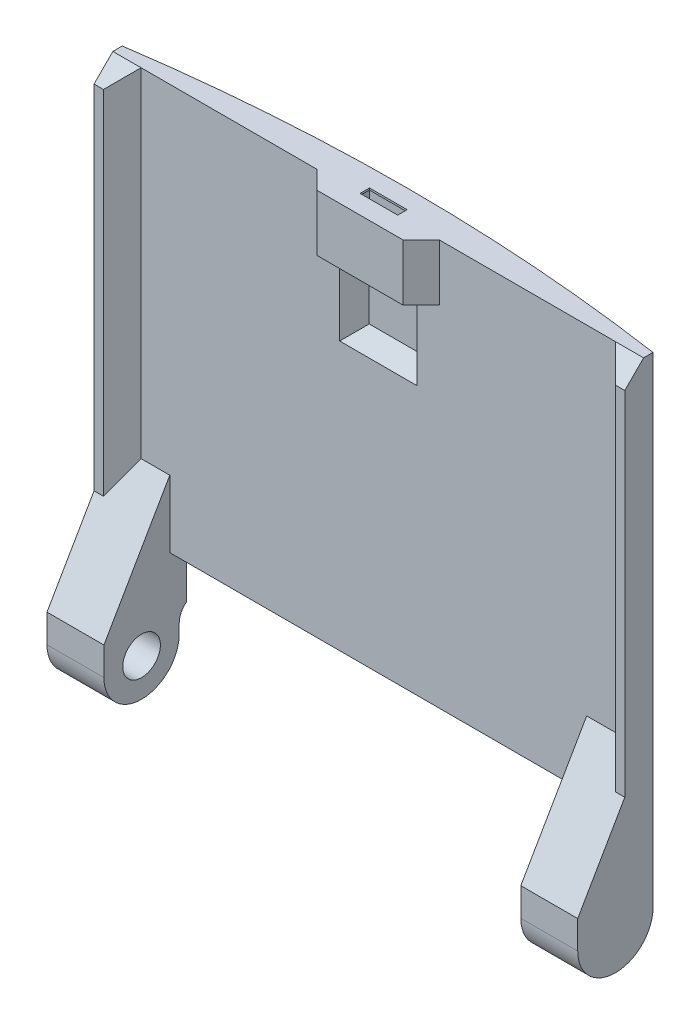
from build123d import *

# Parameters (mm, degrees)
BOSS_EXTRUDE1_DEPTH       = 48.1
SKETCH2_R                 = 2
BOSS_EXTRUDE2_DEPTH       = 6.05
CHAMFER1_SIZE2            = 7
CHAMFER1_SIZE             = 12.124355653
CHAMFER1_OF_MIRROR1_SIZE2 = 7
CHAMFER1_OF_MIRROR1_SIZE  = 12.124355653
BOSS_EXTRUDE3_DEPTH       = 1
CHAMFER2_SIZE             = 2
SKETCH4_W                 = 44.3
SKETCH4_H                 = 3.5
LITTLE_BIT_OF_SPACE_DEPTH = 57.194750645
CHAMFER3_SIZE             = 1.5
FILLET1_R                 = 2
SKETCH5_W                 = 9
SKETCH5_H                 = 1.928677783
BOSS_EXTRUDE4_DEPTH       = 6
SKETCH6_W                 = 5
SKETCH6_H                 = 2
CUT_EXTRUDE2_DEPTH        = 13
SKETCH7_W                 = 5
SKETCH7_H                 = 2
SKETCH7_W_2               = 4
SKETCH7_H_2               = 1
BOSS_EXTRUDE5_DEPTH       = 0.2
BOSS_EXTRUDE7_DEPTH       = 1.5
CHAMFER6_SIZE             = 1.5
CHAMFER7_SIZE             = 1.6
CHAMFER8_SIZE             = 2
SKETCH10_W                = 15.27160506
SKETCH10_H                = 9.874411304
CUT_EXTRUDE3_DEPTH        = 203.6826338
SKETCH11_R                = 2
BOSS_EXTRUDE8_DEPTH       = 2


# Read off the part's stored shape, not the designer's step: Boss-Extrude1
# Some blends are built 0.0001 mm under size
with BuildPart() as part:
    # Boss-Extrude1 outline → Boss-Extrude1 (new body)
    with BuildSketch(Plane(origin=(0, 0, 0), x_dir=(1, 0, 0), z_dir=(0, 1, 0))):
        with BuildLine():
            ThreePointArc((28.2, 190.928677783), (0, 193), (-28.2, 190.928677783))
            Line((-28.2, 190.928677783), (-28.2, 189.928677783))
            Line((-28.2, 189.928677783), (28.2, 189.928677783))
            Line((28.2, 189.928677783), (28.2, 190.928677783))
        make_face()
    extrude(amount=BOSS_EXTRUDE1_DEPTH)

    # Sketch2 → Boss-Extrude2 (add)
    with BuildSketch(Plane(origin=(28.2, 0, 0), x_dir=(0, 0, -1), z_dir=(1, 0, 0))):
        with BuildLine():
            Line((190.928677783, 0), (182.928677783, 0))
            Line((182.928677783, 0), (182.928677783, -3))
            ThreePointArc((182.928677783, -3), (186.928677783, -7), (190.928677783, -3))
            Line((190.928677783, -3), (190.928677783, 0))
        make_face()
        with Locations((186.928677783, -3)):
            Circle(SKETCH2_R, mode=Mode.SUBTRACT)
    boss_extrude2 = extrude(amount=-BOSS_EXTRUDE2_DEPTH)

    # Chamfer1
    chamfer1_edges = [part.edges().sort_by_distance(p)[0] for p in [
        (25.175, 0, -189.928677783),
    ]]
    chamfer1_side = [part.faces().sort_by_distance(p)[0] for p in [
        (25.175, 0.14, -189.928677783),
    ]]
    chamfer(chamfer1_edges, length=CHAMFER1_SIZE - 0.0001, length2=CHAMFER1_SIZE2 - 0.0001, reference=chamfer1_side[0])  # a hair under: the kernel refuses the full size

    # Mirror1: Boss-Extrude2 across plane
    add(boss_extrude2.mirror(Plane(origin=(0, 0, 0), x_dir=(0, 0, 1), z_dir=(1, 0, 0))))

    # Chamfer1 of Mirror1
    chamfer1_of_mirror1_edges = [part.edges().sort_by_distance(p)[0] for p in [
        (-25.175, 0, -189.928677783),
    ]]
    chamfer1_of_mirror1_side = [part.faces().sort_by_distance(p)[0] for p in [
        (-25.175, 0.14, -189.928677783),
    ]]
    chamfer(chamfer1_of_mirror1_edges, length=CHAMFER1_OF_MIRROR1_SIZE - 0.0001, length2=CHAMFER1_OF_MIRROR1_SIZE2 - 0.0001, reference=chamfer1_of_mirror1_side[0])  # a hair under: the kernel refuses the full size

    # Sketch3 → Boss-Extrude3 (add)
    with BuildSketch(Plane(origin=(28.2, 0, 0), x_dir=(0, 0, -1), z_dir=(1, 0, 0))):
        Polygon((190.928677783, 48.1), (190.928677783, 8.660254038), (187.928677783, 8.660254038), (187.928677783, 46.1), (189.928677783, 48.1), align=None)
    boss_extrude3 = extrude(amount=-BOSS_EXTRUDE3_DEPTH)

    # Mirror2: Boss-Extrude3 across plane
    add(boss_extrude3.mirror(Plane(origin=(0, 0, 0), x_dir=(0, 0, 1), z_dir=(1, 0, 0))))

    # Chamfer2
    chamfer2_edges = [part.edges().sort_by_distance(p)[0] for p in [
        (-27.2, 30.112127827, -189.928677783),
        (27.2, 30.112127827, -189.928677783),
    ]]
    chamfer(chamfer2_edges, length=CHAMFER2_SIZE - 0.0001)  # a hair under: the kernel refuses the full size

    # Sketch4 → Little bit of space (cut, through all)
    with BuildSketch(Plane.XY.offset(-189.928677783)):
        with Locations((0, 1.75)):
            Rectangle(SKETCH4_W, SKETCH4_H)
    extrude(amount=-LITTLE_BIT_OF_SPACE_DEPTH, mode=Mode.SUBTRACT)

    # Chamfer3
    chamfer3_edges = [part.edges().sort_by_distance(p)[0] for p in [
        (0, 3.5, -189.928677783),
    ]]
    chamfer(chamfer3_edges, length=CHAMFER3_SIZE)

    # Fillet1
    # the kernel refuses this fillet: 2 mm, written as the material it adds along each edge
    with BuildSketch(Plane(origin=(-33.2, 0, -190.928677783), x_dir=(0, 0, -1), z_dir=(1, 0, 0))) as fillet1_piece_1_section:
        with BuildLine():
            CenterArc((FILLET1_R, -FILLET1_R), FILLET1_R, 90, 90)
            Line((0, -FILLET1_R), (0, 0))
            Line((0, 0), (FILLET1_R, 0))
        make_face()
    fillet1_piece_1 = extrude(amount=11.05, mode=Mode.PRIVATE)
    fillet1_piece_1 = fillet1_piece_1 & Plane(origin=(0, -0.599281995, -9e-09), x_dir=(0.14611398964376573, 0, -0.9892677605332044), z_dir=(0, -1, 0)) * Cylinder(192.999999991, 31, mode=Mode.PRIVATE)
    add(fillet1_piece_1)
    with BuildSketch(Plane(origin=(33.2, 0, -190.928677783), x_dir=(0, 0, -1), z_dir=(-1, 0, 0))) as fillet1_piece_2_section:
        with BuildLine():
            CenterArc((FILLET1_R, FILLET1_R), FILLET1_R, 180, 90)
            Line((0, FILLET1_R), (0, 0))
            Line((0, 0), (FILLET1_R, 0))
        make_face()
    fillet1_piece_2 = extrude(amount=11.05, mode=Mode.PRIVATE)
    fillet1_piece_2 = fillet1_piece_2 & Plane(origin=(0, -0.599283958, -9e-09), x_dir=(0.14611398964376573, 0, -0.9892677605332044), z_dir=(0, -1, 0)) * Cylinder(192.999999991, 31, mode=Mode.PRIVATE)
    add(fillet1_piece_2)

    # Sketch5 → Boss-Extrude4 (add)
    with BuildSketch(Plane(origin=(0, 48.1, 0), x_dir=(1, 0, 0), z_dir=(0, 1, 0))):
        with Locations((0, 188.964338892)):
            Rectangle(SKETCH5_W, SKETCH5_H)
    extrude(amount=-BOSS_EXTRUDE4_DEPTH)

    # Sketch6 → Cut-Extrude2 (cut)
    with BuildSketch(Plane(origin=(0, 48.1, 0), x_dir=(1, 0, 0), z_dir=(0, 1, 0))):
        with Locations((0, 190.5)):
            Rectangle(SKETCH6_W, SKETCH6_H)
    extrude(amount=-CUT_EXTRUDE2_DEPTH, mode=Mode.SUBTRACT)

    # Sketch7 → Boss-Extrude5 (add)
    with BuildSketch(Plane(origin=(0, 48.1, 0), x_dir=(1, 0, 0), z_dir=(0, 1, 0))):
        with Locations((0, 190.5)):
            Rectangle(SKETCH7_W, SKETCH7_H)
        with Locations((0, 190.5)):
            Rectangle(SKETCH7_W_2, SKETCH7_H_2, mode=Mode.SUBTRACT)
    extrude(amount=-BOSS_EXTRUDE5_DEPTH)

    # Sketch9 → Boss-Extrude7 (add)
    with BuildSketch(Plane(origin=(0, 48.1, 0), x_dir=(1, 0, 0), z_dir=(0, 1, 0))):
        with BuildLine():
            Line((-2.5, 192.983807611), (-2.5, 191.383807611))
            Line((-2.5, 191.383807611), (2.5, 191.383807611))
            Line((2.5, 191.383807611), (2.5, 192.983807611))
            ThreePointArc((2.5, 192.983807611), (0, 193), (-2.5, 192.983807611))
        make_face()
    extrude(amount=BOSS_EXTRUDE7_DEPTH)

    # Chamfer6
    # the kernel refuses this chamfer: 1.5 mm, written as the material it adds along each edge
    with BuildSketch(Plane(origin=(-2.5, 48.1, -196.841332093), x_dir=(-0.9996219169112968, -0.02749587661058678, 0), z_dir=(0, 0, 1))) as chamfer6_piece_1_section:
        Polygon((CHAMFER6_SIZE * 0.999621916911, -CHAMFER6_SIZE * 0.0274958766106), (-CHAMFER6_SIZE * 0.0274958766106, -CHAMFER6_SIZE * 0.999621916911), (0, 0), align=None)
    chamfer6_piece_1 = extrude(amount=5.457524482, mode=Mode.PRIVATE)
    chamfer6_piece_1 = chamfer6_piece_1 & Plane(origin=(0, 48.593713067, -9e-09), x_dir=(0.14611398964402453, 0, -0.9892677605331662), z_dir=(0, -1, 0)) * Cylinder(192.999999991, 17, mode=Mode.PRIVATE)
    chamfer6_piece_1 = split(chamfer6_piece_1, bisect_by=Plane(origin=(-2.994165451, 49.6, -192.180106011), z_dir=(0, -1, 0)), keep=Keep.TOP, mode=Mode.PRIVATE)
    add(chamfer6_piece_1)
    with BuildSketch(Plane(origin=(2.5, 48.1, -191.383807611), x_dir=(0.9996219169112968, -0.02749587661058678, 0), z_dir=(0, 0, -1))) as chamfer6_piece_2_section:
        Polygon((CHAMFER6_SIZE * 0.999621916911, -CHAMFER6_SIZE * 0.0274958766106), (-CHAMFER6_SIZE * 0.0274958766106, -CHAMFER6_SIZE * 0.999621916911), (0, 0), align=None)
    chamfer6_piece_2 = extrude(amount=5.457524482, mode=Mode.PRIVATE)
    chamfer6_piece_2 = chamfer6_piece_2 & Plane(origin=(0, 48.593713067, -9e-09), x_dir=(0.14611398964402453, 0, -0.9892677605331662), z_dir=(0, -1, 0)) * Cylinder(192.999999991, 17, mode=Mode.PRIVATE)
    chamfer6_piece_2 = split(chamfer6_piece_2, bisect_by=Plane(origin=(2.994165451, 49.6, -192.180106011), z_dir=(0, -1, 0)), keep=Keep.TOP, mode=Mode.PRIVATE)
    add(chamfer6_piece_2)

    # Chamfer7
    # the kernel refuses this chamfer: 1.6 mm, written as the material it takes off along each edge
    with BuildSketch(Plane(origin=(-2.5, 42.1, -189.928677783), x_dir=(0.027495876610586577, 0, -0.9996219169112966), z_dir=(0, -1, 0))) as chamfer7_piece_1_section:
        Polygon((CHAMFER7_SIZE * 0.999621916911, -CHAMFER7_SIZE * 0.0274958766106), (-CHAMFER7_SIZE * 0.0274958766106, -CHAMFER7_SIZE * 0.999621916911), (0, 0), align=None)
    chamfer7_piece_1 = extrude(amount=7, mode=Mode.PRIVATE)
    chamfer7_piece_1 = split(chamfer7_piece_1, bisect_by=Plane(origin=(-3.029634844, 38.6, -191.5), z_dir=(0, 0, 1)), keep=Keep.TOP, mode=Mode.PRIVATE)
    add(chamfer7_piece_1, mode=Mode.SUBTRACT)
    with BuildSketch(Plane(origin=(2.5, 35.1, -189.928677783), x_dir=(-0.027495876610586306, 0, -0.9996219169112966), z_dir=(0, 1, 0))) as chamfer7_piece_2_section:
        Polygon((CHAMFER7_SIZE * 0.999621916911, -CHAMFER7_SIZE * 0.0274958766106), (-CHAMFER7_SIZE * 0.0274958766106, -CHAMFER7_SIZE * 0.999621916911), (0, 0), align=None)
    chamfer7_piece_2 = extrude(amount=7, mode=Mode.PRIVATE)
    chamfer7_piece_2 = split(chamfer7_piece_2, bisect_by=Plane(origin=(3.029634844, 38.6, -191.5), z_dir=(0, 0, 1)), keep=Keep.TOP, mode=Mode.PRIVATE)
    add(chamfer7_piece_2, mode=Mode.SUBTRACT)
    with BuildSketch(Plane(origin=(2.5, 35.1, -189.928677783), x_dir=(0, 0.027495876610587656, -0.9996219169112966), z_dir=(-1, 0, 0))) as chamfer7_piece_3_section:
        Polygon((CHAMFER7_SIZE * 0.999621916911, CHAMFER7_SIZE * 0.0274958766106), (-CHAMFER7_SIZE * 0.0274958766106, CHAMFER7_SIZE * 0.999621916911), (0, 0), align=None)
    chamfer7_piece_3 = extrude(amount=5, mode=Mode.PRIVATE)
    chamfer7_piece_3 = split(chamfer7_piece_3, bisect_by=Plane(origin=(0, 34.570365156, -191.5), z_dir=(0, 0, 1)), keep=Keep.TOP, mode=Mode.PRIVATE)
    add(chamfer7_piece_3, mode=Mode.SUBTRACT)
    with BuildSketch(Plane(origin=(-2.5, 42.1, -189.928677783), x_dir=(0.027495876610586577, 0, -0.9996219169112966), z_dir=(0, -1, 0))) as chamfer7_piece_4a_section:
        Polygon((CHAMFER7_SIZE * 0.999621916911, -CHAMFER7_SIZE * 0.0274958766106), (-CHAMFER7_SIZE * 0.0274958766106, -CHAMFER7_SIZE * 0.999621916911), (0, 0), align=None)
    chamfer7_piece_4a = extrude(amount=11.114692781, mode=Mode.PRIVATE)
    chamfer7_piece_4a = split(chamfer7_piece_4a, bisect_by=Plane(origin=(-3.029634844, 33.04265361, -191.5), z_dir=(0, 0, 1)), keep=Keep.TOP, mode=Mode.PRIVATE)
    chamfer7_piece_4a = split(chamfer7_piece_4a, bisect_by=Plane(origin=(-3.029634844, 35.1, -190.452614737), z_dir=(0, -1, 0)), keep=Keep.TOP, mode=Mode.PRIVATE)
    with BuildSketch(Plane(origin=(2.5, 35.1, -189.928677783), x_dir=(0, 0.027495876610587656, -0.9996219169112966), z_dir=(-1, 0, 0))) as chamfer7_piece_4b_section:
        Polygon((CHAMFER7_SIZE * 0.999621916911, CHAMFER7_SIZE * 0.0274958766106), (-CHAMFER7_SIZE * 0.0274958766106, CHAMFER7_SIZE * 0.999621916911), (0, 0), align=None)
    chamfer7_piece_4b = extrude(amount=9.114692781, mode=Mode.PRIVATE)
    chamfer7_piece_4b = split(chamfer7_piece_4b, bisect_by=Plane(origin=(-2.5, 34.570365156, -190.452614737), z_dir=(-1, 0, 0)), keep=Keep.TOP, mode=Mode.PRIVATE)
    chamfer7_piece_4b = split(chamfer7_piece_4b, bisect_by=Plane(origin=(-4.55734639, 34.570365156, -191.5), z_dir=(0, 0, 1)), keep=Keep.TOP, mode=Mode.PRIVATE)
    chamfer7_piece_4 = chamfer7_piece_4a & chamfer7_piece_4b
    add(chamfer7_piece_4, mode=Mode.SUBTRACT)
    with BuildSketch(Plane(origin=(6.614692781, 35.1, -189.928677783), x_dir=(0, 0.027495876610587656, -0.9996219169112966), z_dir=(-1, 0, 0))) as chamfer7_piece_5a_section:
        Polygon((CHAMFER7_SIZE * 0.999621916911, CHAMFER7_SIZE * 0.0274958766106), (-CHAMFER7_SIZE * 0.0274958766106, CHAMFER7_SIZE * 0.999621916911), (0, 0), align=None)
    chamfer7_piece_5a = extrude(amount=9.114692781, mode=Mode.PRIVATE)
    chamfer7_piece_5a = split(chamfer7_piece_5a, bisect_by=Plane(origin=(2.5, 34.570365156, -190.452614737), z_dir=(1, 0, 0)), keep=Keep.TOP, mode=Mode.PRIVATE)
    chamfer7_piece_5a = split(chamfer7_piece_5a, bisect_by=Plane(origin=(4.55734639, 34.570365156, -191.5), z_dir=(0, 0, 1)), keep=Keep.TOP, mode=Mode.PRIVATE)
    with BuildSketch(Plane(origin=(2.5, 30.985307219, -189.928677783), x_dir=(-0.027495876610586577, 0, -0.9996219169112966), z_dir=(0, 1, 0))) as chamfer7_piece_5b_section:
        Polygon((CHAMFER7_SIZE * 0.999621916911, -CHAMFER7_SIZE * 0.0274958766106), (-CHAMFER7_SIZE * 0.0274958766106, -CHAMFER7_SIZE * 0.999621916911), (0, 0), align=None)
    chamfer7_piece_5b = extrude(amount=11.114692781, mode=Mode.PRIVATE)
    chamfer7_piece_5b = split(chamfer7_piece_5b, bisect_by=Plane(origin=(3.029634844, 35.1, -190.452614737), z_dir=(0, -1, 0)), keep=Keep.TOP, mode=Mode.PRIVATE)
    chamfer7_piece_5b = split(chamfer7_piece_5b, bisect_by=Plane(origin=(3.029634844, 33.04265361, -191.5), z_dir=(0, 0, 1)), keep=Keep.TOP, mode=Mode.PRIVATE)
    chamfer7_piece_5 = chamfer7_piece_5a & chamfer7_piece_5b
    add(chamfer7_piece_5, mode=Mode.SUBTRACT)

    # Chamfer8
    # the kernel refuses this chamfer: 2 mm, written as the material it adds along each edge
    with BuildSketch(Plane(origin=(-4.5, 48.1, -189.928677783), x_dir=(-0.9996219169125519, 0, -0.027495876564955297), z_dir=(0, -1, 0))) as chamfer8_piece_1_section:
        Polygon((CHAMFER8_SIZE * 0.999621916911, -CHAMFER8_SIZE * 0.0274958766112), (-CHAMFER8_SIZE * 0.027495876565, -CHAMFER8_SIZE * 0.999621916913), (0, 0), align=None)
    chamfer8_piece_1 = extrude(amount=6, mode=Mode.PRIVATE)
    chamfer8_piece_1 = split(chamfer8_piece_1, bisect_by=Plane(origin=(-5.163599307, 45.1, -188), z_dir=(0, 0, -1)), keep=Keep.TOP, mode=Mode.PRIVATE)
    add(chamfer8_piece_1)
    with BuildSketch(Plane(origin=(4.5, 48.1, -189.928677783), x_dir=(0.9996219169125516, 0, -0.02749587656495524), z_dir=(0, -1, 0))) as chamfer8_piece_2_section:
        Polygon((CHAMFER8_SIZE * 0.999621916911, CHAMFER8_SIZE * 0.0274958766112), (-CHAMFER8_SIZE * 0.027495876565, CHAMFER8_SIZE * 0.999621916913), (0, 0), align=None)
    chamfer8_piece_2 = extrude(amount=6, mode=Mode.PRIVATE)
    chamfer8_piece_2 = split(chamfer8_piece_2, bisect_by=Plane(origin=(5.163599307, 45.1, -188), z_dir=(0, 0, -1)), keep=Keep.TOP, mode=Mode.PRIVATE)
    add(chamfer8_piece_2)

    # Sketch10 → Cut-Extrude3 (cut, through all)
    with BuildSketch(Plane(origin=(0, 48.1, 0), x_dir=(1, 0, 0), z_dir=(0, 1, 0))):
        with Locations((-0.319497541, 192.732882239)):
            Rectangle(SKETCH10_W, SKETCH10_H)
    extrude(amount=CUT_EXTRUDE3_DEPTH, mode=Mode.SUBTRACT)

    # Sketch11 → Boss-Extrude8 (add)
    with BuildSketch(Plane(origin=(28.2, 0, 0), x_dir=(0, 0, -1), z_dir=(1, 0, 0))):
        with Locations((186.928677783, -3)):
            Circle(SKETCH11_R)
    boss_extrude8 = extrude(amount=-BOSS_EXTRUDE8_DEPTH)

    # Mirror3: Boss-Extrude8 across plane
    add(boss_extrude8.mirror(Plane(origin=(0, 0, 0), x_dir=(0, 0, 1), z_dir=(1, 0, 0))))


solid = part.part
